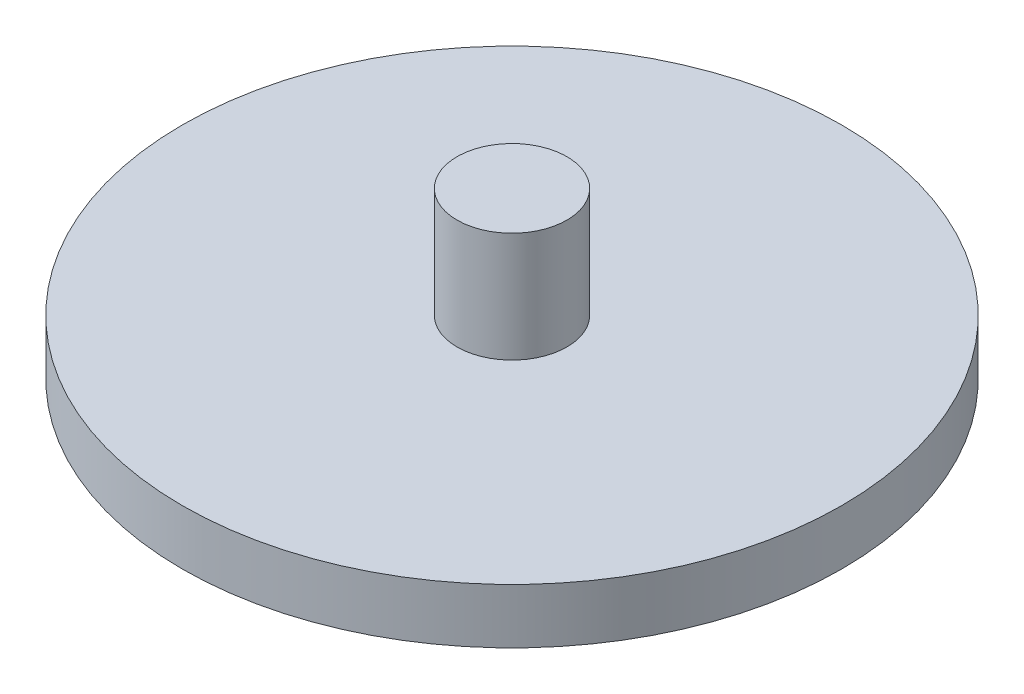
from build123d import *

# Parameters (mm, degrees)
SKETCH1_R           = 25.4
BOSS_EXTRUDE1_DEPTH = 50.8
SKETCH2_R           = 152.4
BOSS_EXTRUDE2_DEPTH = 25.4
SKETCH3_W           = 127
SKETCH3_H           = 55.88
BOSS_EXTRUDE3_DEPTH = 55.88
SKETCH4_R           = 20.32
CUT_EXTRUDE1_DEPTH  = 277.486904572


with BuildPart() as part:
    # Sketch1 → Boss-Extrude1 (new body)
    with BuildSketch(Plane(origin=(0, 0, 0), x_dir=(1, 0, 0), z_dir=(0, 1, 0))):
        Circle(SKETCH1_R)
    extrude(amount=BOSS_EXTRUDE1_DEPTH)

    # Sketch2 → Boss-Extrude2 (add)
    with BuildSketch(Plane.XZ):
        Circle(SKETCH2_R)
    extrude(amount=BOSS_EXTRUDE2_DEPTH)

    # Sketch3 → Boss-Extrude3 (add)
    with BuildSketch(Plane.XZ.offset(25.4)):
        Rectangle(SKETCH3_W, SKETCH3_H)
    extrude(amount=BOSS_EXTRUDE3_DEPTH)

    # Sketch4 → Cut-Extrude1 (cut, through all)
    with BuildSketch(Plane.ZY.offset(63.5)):
        with Locations((0, -53.34)):
            Circle(SKETCH4_R)
    extrude(amount=-CUT_EXTRUDE1_DEPTH, mode=Mode.SUBTRACT)


solid = part.part
